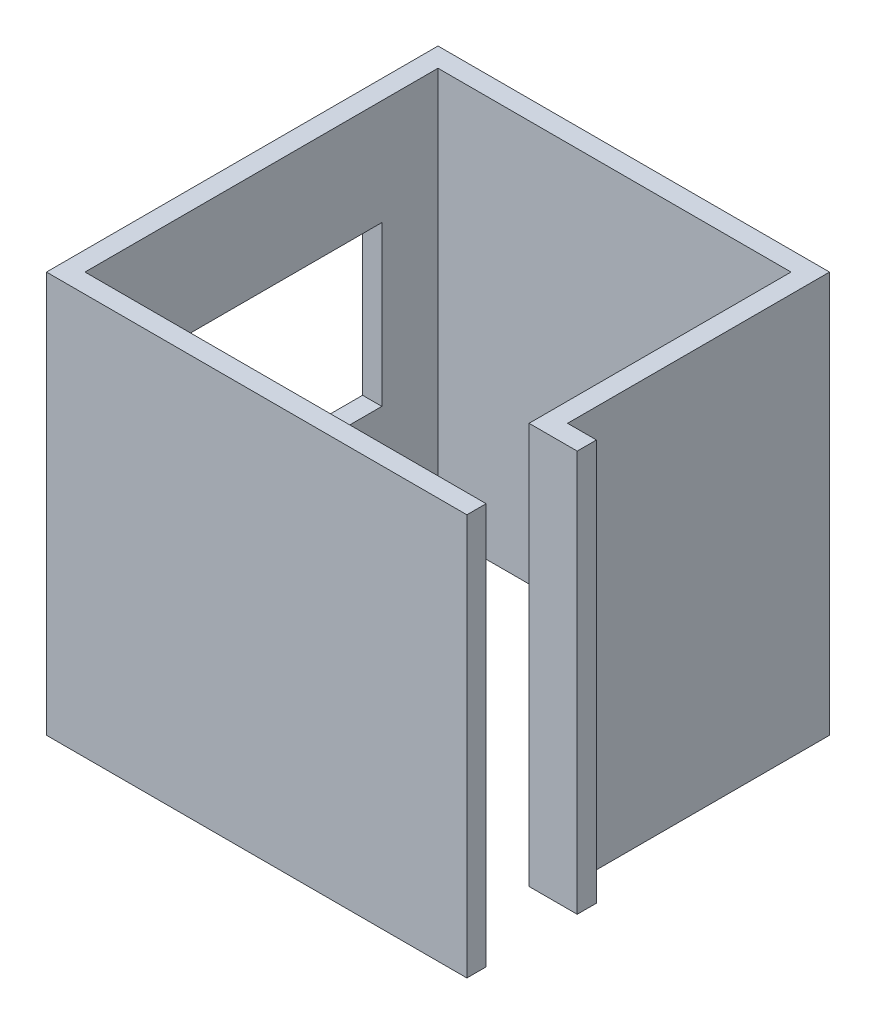
from build123d import *

# Parameters (mm, degrees)
EXTRUDE_1_DEPTH     = 2500
CUT_EXTRUDE_1_REACH = 4302.791
SKETCH_2_W          = 1200
SKETCH_2_H          = 992.146059398


with BuildPart() as part:
    # Эскиз1 → Вытянуть-Тонкостенный1 (new body)
    with BuildSketch(Plane(origin=(0, 0, 0), x_dir=(1, 0, 0), z_dir=(0, 1, 0))):
        Polygon((2500, 0), (0, 0), (0, 2200), (2200, 2200), (2200, 567.519182489), (2500, 567.519182489), (2500, 687.519182489), (2320, 687.519182489), (2320, 2320), (-120, 2320), (-120, -120), (2500, -120), align=None)
    extrude(amount=EXTRUDE_1_DEPTH)

    # Эскиз2 → Вырез-Вытянуть1 (cut, up to next)
    with BuildSketch(Plane.ZY.offset(120), mode=Mode.PRIVATE) as cut_extrude_1_sk1:
        with Locations((-1250, 1346.073029699)):
            Rectangle(SKETCH_2_W, SKETCH_2_H)
    cut_extrude_1_tool1 = extrude(cut_extrude_1_sk1.sketch, amount=-CUT_EXTRUDE_1_REACH, mode=Mode.PRIVATE) & part.part
    add(cut_extrude_1_tool1.solids().sort_by_distance((-120, 1346.07303, -1250))[0], mode=Mode.SUBTRACT)


solid = part.part
